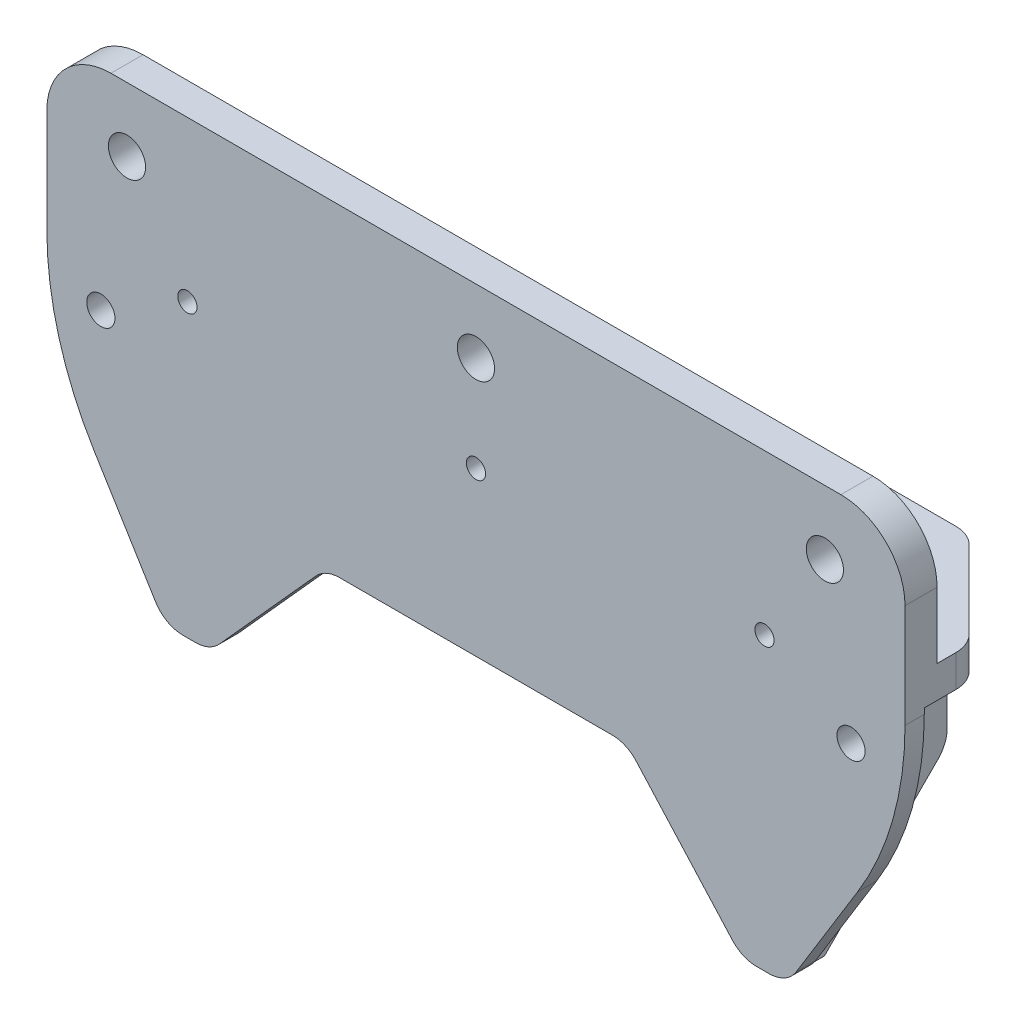
from build123d import *

# Parameters (mm, degrees)
SZKIC1_R                    = 2.9
SZKIC1_W                    = 18.41841252
SZKIC1_H                    = 5
SZKIC1_W_2                  = 7
SZKIC1_H_2                  = 45
SZKIC1_R_2                  = 2.2
SZKIC1_W_3                  = 38
DODANIE_WYCI_GNI_CIE1_DEPTH = 5
SZKIC1_3_W                  = 18.41841252
SZKIC1_3_H                  = 5
SZKIC1_3_W_2                = 7
SZKIC1_3_W_3                = 38
SZKIC1_3_H_2                = 45
DODANIE_WYCI_GNI_CIE2_DEPTH = 20
SFAZOWANIE1_SIZE            = 20
SFAZOWANIE2_SIZE            = 15
WYTNIJ_WYCI_GNI_CIE1_DEPTH  = 82.712994064
SZKIC4_W                    = 7
SZKIC4_H                    = 20
WYTNIJ_WYCI_GNI_CIE2_DEPTH  = 84.078356982
SFAZOWANIE3_SIZE            = 20
ZAOKR_GLENIE1_R             = 5
ZAOKR_GLENIE2_R             = 5
ZAOKR_GLENIE3_R             = 10
SZKIC5_R                    = 1.5
WYTNIJ_WYCI_GNI_CIE3_DEPTH  = 84.078356982
SZKIC6_R                    = 3.5
WYTNIJ_WYCI_GNI_CIE4_DEPTH  = 5
ZAOKR_GLENIE4_R             = 2
ZAOKR_GLENIE5_R             = 5
ZAOKR_GLENIE6_R             = 50
SZKIC7_R                    = 2.8
WYTNIJ_WYCI_GNI_CIE5_DEPTH  = 4.6
SFAZOWANIE4_SIZE            = 2


with BuildPart() as part:
    # Szkic1 → Dodanie-wyciągnięcie1 (new body)
    # profile 1 of 15: a face of its own
    with BuildSketch(Plane.XY):
        Polygon((69.385377552, 17.945036029), (69.385377552, 38.245036029), (-64.451447488, 38.245036029), (-64.451447488, 17.945036029), (-46.033034968, 17.945036029), (-39.033034968, 17.945036029), (-1.033034968, 17.945036029), (5.966965032, 17.945036029), (43.966965032, 17.945036029), (50.966965032, 17.945036029), align=None)
        with Locations((-51.951447488, 28.245036029)):
            Circle(SZKIC1_R, mode=Mode.SUBTRACT)
        with Locations((2.466965032, 28.245036029)):
            Circle(SZKIC1_R, mode=Mode.SUBTRACT)
        with Locations((56.885377552, 28.245036029)):
            Circle(SZKIC1_R, mode=Mode.SUBTRACT)
    # profile 2 of 15: a face of its own
    with BuildSketch(Plane.XY):
        with Locations((60.176171292, 15.445036029)):
            Rectangle(SZKIC1_W, SZKIC1_H)
    # profile 3 of 15: a face of its own
    with BuildSketch(Plane.XY):
        with Locations((47.466965032, 15.445036029)):
            Rectangle(SZKIC1_W_2, SZKIC1_H)
    # profile 4 of 15: a face of its own
    with BuildSketch(Plane.XY):
        with Locations((60.176171292, -9.554963971)):
            Rectangle(SZKIC1_W, SZKIC1_H_2)
        with Locations((60.966965032, 5.445036029)):
            Circle(SZKIC1_R_2, mode=Mode.SUBTRACT)
    # profile 5 of 15: a face of its own
    with BuildSketch(Plane.XY):
        with Locations((-55.242241228, 15.445036029)):
            Rectangle(SZKIC1_W, SZKIC1_H)
    # profile 6 of 15: a face of its own
    with BuildSketch(Plane.XY):
        with Locations((24.966965032, 15.445036029)):
            Rectangle(SZKIC1_W_3, SZKIC1_H)
    # profile 7 of 15: a face of its own
    with BuildSketch(Plane.XY):
        with Locations((47.466965032, -9.554963971)):
            Rectangle(SZKIC1_W_2, SZKIC1_H_2)
    # profile 8 of 15: a face of its own
    with BuildSketch(Plane.XY):
        with Locations((-42.533034968, 15.445036029)):
            Rectangle(SZKIC1_W_2, SZKIC1_H)
    # profile 9 of 15: a face of its own
    with BuildSketch(Plane.XY):
        with Locations((-55.242241228, -9.554963971)):
            Rectangle(SZKIC1_W, SZKIC1_H_2)
        with Locations((-56.033034968, 5.445036029)):
            Circle(SZKIC1_R_2, mode=Mode.SUBTRACT)
    # profile 10 of 15: a face of its own
    with BuildSketch(Plane.XY):
        with Locations((2.466965032, 15.445036029)):
            Rectangle(SZKIC1_W_2, SZKIC1_H)
    # profile 11 of 15: a face of its own
    with BuildSketch(Plane.XY):
        with Locations((24.966965032, -9.554963971)):
            Rectangle(SZKIC1_W_3, SZKIC1_H_2)
    # profile 12 of 15: a face of its own
    with BuildSketch(Plane.XY):
        with Locations((-20.033034968, 15.445036029)):
            Rectangle(SZKIC1_W_3, SZKIC1_H)
    # profile 13 of 15: a face of its own
    with BuildSketch(Plane.XY):
        with Locations((-42.533034968, -9.554963971)):
            Rectangle(SZKIC1_W_2, SZKIC1_H_2)
    # profile 14 of 15: a face of its own
    with BuildSketch(Plane.XY):
        with Locations((2.466965032, -9.554963971)):
            Rectangle(SZKIC1_W_2, SZKIC1_H_2)
    # profile 15 of 15: a face of its own
    with BuildSketch(Plane.XY):
        with Locations((-20.033034968, -9.554963971)):
            Rectangle(SZKIC1_W_3, SZKIC1_H_2)
    extrude(amount=DODANIE_WYCI_GNI_CIE1_DEPTH)

    # Szkic1<3> → Dodanie-wyciągnięcie2 (add)
    with BuildSketch(Plane.XY):
        with Locations((-55.242241228, 15.445036029)):
            Rectangle(SZKIC1_3_W, SZKIC1_3_H)
        with Locations((-42.533034968, 15.445036029)):
            Rectangle(SZKIC1_3_W_2, SZKIC1_3_H)
        with Locations((-20.033034968, 15.445036029)):
            Rectangle(SZKIC1_3_W_3, SZKIC1_3_H)
        with Locations((2.466965032, 15.445036029)):
            Rectangle(SZKIC1_3_W_2, SZKIC1_3_H)
        with Locations((24.966965032, 15.445036029)):
            Rectangle(SZKIC1_3_W_3, SZKIC1_3_H)
        with Locations((47.466965032, 15.445036029)):
            Rectangle(SZKIC1_3_W_2, SZKIC1_3_H)
        with Locations((60.176171292, 15.445036029)):
            Rectangle(SZKIC1_3_W, SZKIC1_3_H)
        with Locations((47.466965032, -9.554963971)):
            Rectangle(SZKIC1_3_W_2, SZKIC1_3_H_2)
        with Locations((2.466965032, -9.554963971)):
            Rectangle(SZKIC1_3_W_2, SZKIC1_3_H_2)
        with Locations((-42.533034968, -9.554963971)):
            Rectangle(SZKIC1_3_W_2, SZKIC1_3_H_2)
    extrude(amount=-DODANIE_WYCI_GNI_CIE2_DEPTH)

    # Sfazowanie1
    sfazowanie1_edges = [part.edges().sort_by_distance(p)[0] for p in [
        (47.466965032, -32.054963971, -20),
        (2.466965032, -32.054963971, -20),
        (-42.533034968, -32.054963971, -20),
    ]]
    chamfer(sfazowanie1_edges, length=SFAZOWANIE1_SIZE)

    # Sfazowanie2
    sfazowanie2_edges = [part.edges().sort_by_distance(p)[0] for p in [
        (-64.451447488, 15.445036029, -20),
        (69.385377552, 15.445036029, -20),
    ]]
    chamfer(sfazowanie2_edges, length=SFAZOWANIE2_SIZE)

    # Szkic3 → Wytnij-wyciągnięcie1 (cut, through all)
    with BuildSketch(Plane(origin=(0, 0, 0), x_dir=(-1, 0, 0), z_dir=(0, 0, -1))):
        Polygon((-69.385377552, -2.054963971), (-50.966965032, -32.054963971), (-69.385377552, -32.054963971), align=None)
        Polygon((64.451447488, -32.054963971), (64.451447488, -2.054963971), (46.033034968, -32.054963971), align=None)
    extrude(amount=-WYTNIJ_WYCI_GNI_CIE1_DEPTH, mode=Mode.SUBTRACT)

    # Szkic4 → Wytnij-wyciągnięcie2 (cut, through all)
    with BuildSketch(Plane(origin=(0, 0, -20), x_dir=(-1, 0, 0), z_dir=(0, 0, -1))):
        Polygon((21.033034968, -12.054963971), (-25.966965032, -12.054963971), (-43.966965032, -32.054963971), (39.033034968, -32.054963971), align=None)
        with Locations((-2.466965032, -22.054963971)):
            Rectangle(SZKIC4_W, SZKIC4_H)
    extrude(amount=-WYTNIJ_WYCI_GNI_CIE2_DEPTH, mode=Mode.SUBTRACT)

    # Sfazowanie3
    sfazowanie3_edges = [part.edges().sort_by_distance(p)[0] for p in [
        (2.466965032, -12.054963971, -20),
    ]]
    chamfer(sfazowanie3_edges, length=SFAZOWANIE3_SIZE)

    # Zaokrąglenie1
    zaokr_glenie1_edges = [part.edges().sort_by_distance(p)[0] for p in [
        (-46.033034968, 12.945036029, -10),
        (-39.033034968, 12.945036029, -10),
        (-1.033034968, 12.945036029, -10),
        (5.966965032, 12.945036029, -10),
        (43.966965032, 12.945036029, -10),
        (50.966965032, 12.945036029, -10),
    ]]
    fillet(zaokr_glenie1_edges, radius=ZAOKR_GLENIE1_R)

    # Zaokrąglenie2
    zaokr_glenie2_edges = [part.edges().sort_by_distance(p)[0] for p in [
        (-64.451447488, 15.445036029, -5),
        (54.385377552, 15.316669487, -20),
        (-49.451447488, 15.316669487, -20),
        (69.385377552, 15.445036029, -5),
        (50.966965032, -32.054963971, 2.5),
        (-46.033034968, -32.054963971, 2.5),
        (43.966965032, -32.054963971, 2.5),
        (-39.033034968, -32.054963971, 2.5),
        (-42.533034968, -12.054963971, -20),
        (47.466965032, -12.054963971, -20),
    ]]
    fillet(zaokr_glenie2_edges, radius=ZAOKR_GLENIE2_R)

    # Zaokrąglenie3
    zaokr_glenie3_edges = [part.edges().sort_by_distance(p)[0] for p in [
        (-64.451447488, 38.245036029, 2.5),
        (69.385377552, 38.245036029, 2.5),
    ]]
    fillet(zaokr_glenie3_edges, radius=ZAOKR_GLENIE3_R)

    # Szkic5 → Wytnij-wyciągnięcie3 (cut, through all)
    with BuildSketch(Plane(origin=(0, 0, -20), x_dir=(-1, 0, 0), z_dir=(0, 0, -1))):
        with Locations((-2.466965032, 13.335528763)):
            Circle(SZKIC5_R)
        with Locations((-47.466965032, 13.335528763)):
            Circle(SZKIC5_R)
        with Locations(Location((42.533034968, 13.335528763, 0), (0, 0, 180))):
            Circle(SZKIC5_R)
    extrude(amount=-WYTNIJ_WYCI_GNI_CIE3_DEPTH, mode=Mode.SUBTRACT)

    # Szkic6 → Wytnij-wyciągnięcie4 (cut)
    with BuildSketch(Plane(origin=(0, 0, -20), x_dir=(-1, 0, 0), z_dir=(0, 0, -1))):
        with Locations((-47.466965032, 13.335528763)):
            Circle(SZKIC6_R)
        with Locations((-2.466965032, 13.335528763)):
            Circle(SZKIC6_R)
        with Locations((42.533034968, 13.335528763)):
            Circle(SZKIC6_R)
    extrude(amount=-WYTNIJ_WYCI_GNI_CIE4_DEPTH, mode=Mode.SUBTRACT)

    # Zaokrąglenie4
    zaokr_glenie4_edges = [part.edges().sort_by_distance(p)[0] for p in [
        (2.466965032, 7.945036029, -20),
    ]]
    fillet(zaokr_glenie4_edges, radius=ZAOKR_GLENIE4_R)

    # Zaokrąglenie5
    zaokr_glenie5_edges = [part.edges().sort_by_distance(p)[0] for p in [
        (-21.033034968, -12.054963971, 2.5),
        (25.966965032, -12.054963971, 2.5),
    ]]
    fillet(zaokr_glenie5_edges, radius=ZAOKR_GLENIE5_R)

    # Zaokrąglenie6
    zaokr_glenie6_edges = [part.edges().sort_by_distance(p)[0] for p in [
        (69.385377552, -2.054963971, 2.5),
        (-64.451447488, -2.054963971, 2.5),
    ]]
    fillet(zaokr_glenie6_edges, radius=ZAOKR_GLENIE6_R)

    # Szkic7 → Wytnij-wyciągnięcie5 (cut)
    with BuildSketch(Plane.XZ.offset(-12.945036029)):
        with Locations(Location((24.966965032, -10.3, 0), (0, 0, 270))):
            Circle(SZKIC7_R)
        with Locations(Location((-20.033034968, -10.3, 0), (0, 0, 270))):
            Circle(SZKIC7_R)
    extrude(amount=-WYTNIJ_WYCI_GNI_CIE5_DEPTH, mode=Mode.SUBTRACT)

    # Sfazowanie4
    # the kernel refuses this chamfer: 2 mm, written as the material it takes off along each edge
    with BuildSketch(Plane(origin=(-1.033034968, -12.054963971, 0), x_dir=(0, -0.027495876610586494, 0.9996219169112968), z_dir=(-1, 0, 0)), Plane(origin=(23.740153008, -12.054963971, 0), x_dir=(0, -0.027495876610586487, 0.9996219169112968), z_dir=(-1, 0, 0))) as sfazowanie4_piece_1:
        Polygon((SFAZOWANIE4_SIZE * 0.999621916911, SFAZOWANIE4_SIZE * 0.0274958766106), (-SFAZOWANIE4_SIZE * 0.0274958766106, SFAZOWANIE4_SIZE * 0.999621916911), (0, 0), align=None)
    extrude(amount=17.773187976, mode=Mode.SUBTRACT)
    with BuildSketch(Plane(origin=(-43.23563518, -27.054963971, 0), x_dir=(0.42136088994034965, -0.906893047954761, 0), z_dir=(0.906893047954761, 0.42136088994034965, 0))) as sfazowanie4_piece_2_section:
        Polygon((5, -SFAZOWANIE4_SIZE), (5 - SFAZOWANIE4_SIZE, 0), (5, 0), align=None)
    sfazowanie4_piece_2 = revolve(axis=Axis((-43.23563518, -27.054963971, 0), (0, 0, -1)), revolution_arc=83.372812861, mode=Mode.PRIVATE)
    sfazowanie4_piece_2 = split(sfazowanie4_piece_2, bisect_by=Plane(origin=(-46.033034968, -30.045933354, 0.764134298), z_dir=(-1, 0, 0)), keep=Keep.TOP, mode=Mode.PRIVATE)
    add(sfazowanie4_piece_2, mode=Mode.SUBTRACT)
    with BuildSketch(Plane(origin=(-22.522693676, -13.710140313, 0), x_dir=(0.02043752413058321, -0.01839377171752488, 0.9996219169112968), z_dir=(-0.6689647316224495, -0.7432941462471666, 0)), Plane(origin=(42.477306324, -30.399787629, 0), x_dir=(-0.02043752413058301, -0.018393771717524706, 0.9996219169112968), z_dir=(-0.6689647316224496, 0.7432941462471665, 0))) as sfazowanie4_piece_3:
        Polygon((SFAZOWANIE4_SIZE * 0.999621916911, SFAZOWANIE4_SIZE * 0.0274958766106), (-SFAZOWANIE4_SIZE * 0.0274958766106, SFAZOWANIE4_SIZE * 0.999621916911), (0, 0), align=None)
    extrude(amount=22.453624047, mode=Mode.SUBTRACT)
    with BuildSketch(Plane(origin=(-41.259846992, -27.054963971, 0), x_dir=(-0.5372033961854771, -0.8434527320050539, 0), z_dir=(-0.8434527320050539, 0.5372033961854771, 0))) as sfazowanie4_piece_4_section:
        Polygon((5, SFAZOWANIE4_SIZE), (5 - SFAZOWANIE4_SIZE, 0), (5, 0), align=None)
    sfazowanie4_piece_4 = revolve(axis=Axis((-41.259846992, -27.054963971, 0), (0, 0, 1)), revolution_arc=80.506251571, mode=Mode.PRIVATE)
    sfazowanie4_piece_4 = split(sfazowanie4_piece_4, bisect_by=Plane(origin=(-39.033034968, -30.533722869, 0.745420037), z_dir=(1, 0, 0)), keep=Keep.TOP, mode=Mode.PRIVATE)
    add(sfazowanie4_piece_4, mode=Mode.SUBTRACT)
    with BuildSketch(Plane(origin=(46.193777055, -27.054963971, 0), x_dir=(0.5372033961854854, -0.8434527320050487, 0), z_dir=(0.8434527320050487, 0.5372033961854854, 0))) as sfazowanie4_piece_5_section:
        Polygon((5, -SFAZOWANIE4_SIZE), (5 - SFAZOWANIE4_SIZE, 0), (5, 0), align=None)
    sfazowanie4_piece_5 = revolve(axis=Axis((46.193777055, -27.054963971, 0), (0, 0, -1)), revolution_arc=80.506251571, mode=Mode.PRIVATE)
    sfazowanie4_piece_5 = split(sfazowanie4_piece_5, bisect_by=Plane(origin=(43.966965032, -30.533722869, 0.745420037), z_dir=(-1, 0, 0)), keep=Keep.TOP, mode=Mode.PRIVATE)
    add(sfazowanie4_piece_5, mode=Mode.SUBTRACT)
    with BuildSketch(Plane(origin=(61.995610849, -14.09145196, 0), x_dir=(0.02343211434184364, -0.014386078272250682, 0.9996219169112968), z_dir=(-0.5232085696337507, -0.8522046659469805, 0))) as sfazowanie4_piece_6_section:
        Polygon((SFAZOWANIE4_SIZE * 0.999621916911, SFAZOWANIE4_SIZE * 0.0274958766106), (-SFAZOWANIE4_SIZE * 0.0274958766106, SFAZOWANIE4_SIZE * 0.999621916911), (0, 0), align=None)
    sfazowanie4_piece_6 = extrude(amount=18.281470968, mode=Mode.PRIVATE)
    sfazowanie4_piece_6 = split(sfazowanie4_piece_6, bisect_by=Plane(origin=(50.966965032, -23.432298347, 0.774377274), z_dir=(1, 0, 0)), keep=Keep.TOP, mode=Mode.PRIVATE)
    add(sfazowanie4_piece_6, mode=Mode.SUBTRACT)
    with BuildSketch(Plane(origin=(48.169565244, -27.054963971, 0), x_dir=(-0.4213608899403493, -0.9068930479547611, 0), z_dir=(-0.9068930479547611, 0.4213608899403493, 0))) as sfazowanie4_piece_7_section:
        Polygon((5, SFAZOWANIE4_SIZE), (5 - SFAZOWANIE4_SIZE, 0), (5, 0), align=None)
    sfazowanie4_piece_7 = revolve(axis=Axis((48.169565244, -27.054963971, 0), (0, 0, 1)), revolution_arc=83.372812861, mode=Mode.PRIVATE)
    sfazowanie4_piece_7 = split(sfazowanie4_piece_7, bisect_by=Plane(origin=(50.966965032, -30.045933354, 0.764134298), z_dir=(1, 0, 0)), keep=Keep.TOP, mode=Mode.PRIVATE)
    add(sfazowanie4_piece_7, mode=Mode.SUBTRACT)
    with BuildSketch(Plane(origin=(-64.451447488, 12.068976521, 0), x_dir=(-0.02749587661058217, 0, 0.9996219169112968), z_dir=(0, 1, 0))) as sfazowanie4_piece_8:
        Polygon((SFAZOWANIE4_SIZE * 0.999621916911, SFAZOWANIE4_SIZE * 0.0274958766106), (-SFAZOWANIE4_SIZE * 0.0274958766106, SFAZOWANIE4_SIZE * 0.999621916911), (0, 0), align=None)
    extrude(amount=0.876059508, mode=Mode.SUBTRACT)
    with BuildSketch(Plane(origin=(69.385377552, 12.068976521, 0), x_dir=(0.02749587661058908, 0, 0.9996219169112968), z_dir=(0, 1, 0))) as sfazowanie4_piece_9:
        Polygon((SFAZOWANIE4_SIZE * 0.999621916911, -SFAZOWANIE4_SIZE * 0.0274958766106), (-SFAZOWANIE4_SIZE * 0.0274958766106, -SFAZOWANIE4_SIZE * 0.999621916911), (0, 0), align=None)
    extrude(amount=0.876059508, mode=Mode.SUBTRACT)
    with BuildSketch(Plane(origin=(-18.806222945, -17.054963971, 0), x_dir=(-0.7432941462471667, 0.6689647316224491, 0), z_dir=(-0.6689647316224491, -0.7432941462471667, 0))) as sfazowanie4_piece_10:
        Polygon((5, -SFAZOWANIE4_SIZE), (5 + SFAZOWANIE4_SIZE, 0), (5, 0), align=None)
    revolve(axis=Axis((-18.806222945, -17.054963971, 0), (0, 0, -1)), revolution_arc=48.012787504, mode=Mode.SUBTRACT)
    with BuildSketch(Plane(origin=(23.740153008, -17.054963971, 0), x_dir=(0, 1, 0), z_dir=(-1, 0, 0))) as sfazowanie4_piece_11:
        Polygon((5, -SFAZOWANIE4_SIZE), (5 + SFAZOWANIE4_SIZE, 0), (5, 0), align=None)
    revolve(axis=Axis((23.740153008, -17.054963971, 0), (0, 0, -1)), revolution_arc=48.012787504, mode=Mode.SUBTRACT)
    with BuildSketch(Plane(origin=(19.385377552, 12.068976521, 0), x_dir=(0.8522046659469805, -0.5232085696337508, 0), z_dir=(-0.5232085696337508, -0.8522046659469805, 0))) as sfazowanie4_piece_12:
        Polygon((50, SFAZOWANIE4_SIZE), (50 - SFAZOWANIE4_SIZE, 0), (50, 0), align=None)
    revolve(axis=Axis((19.385377552, 12.068976521, 0), (0, 0, 1)), revolution_arc=31.54772315, mode=Mode.SUBTRACT)
    with BuildSketch(Plane(origin=(-57.061680786, -14.09145196, 0), x_dir=(-0.023432114341843627, -0.014386078272250705, 0.9996219169112968), z_dir=(0.5232085696337515, -0.8522046659469801, 0))) as sfazowanie4_piece_13_section:
        Polygon((SFAZOWANIE4_SIZE * 0.999621916911, -SFAZOWANIE4_SIZE * 0.0274958766106), (-SFAZOWANIE4_SIZE * 0.0274958766106, -SFAZOWANIE4_SIZE * 0.999621916911), (0, 0), align=None)
    sfazowanie4_piece_13 = extrude(amount=18.281470968, mode=Mode.PRIVATE)
    sfazowanie4_piece_13 = split(sfazowanie4_piece_13, bisect_by=Plane(origin=(-46.033034968, -23.432298347, 0.774377274), z_dir=(-1, 0, 0)), keep=Keep.TOP, mode=Mode.PRIVATE)
    add(sfazowanie4_piece_13, mode=Mode.SUBTRACT)
    with BuildSketch(Plane(origin=(-14.451447488, 12.068976521, 0), x_dir=(-0.8522046659469801, -0.5232085696337514, 0), z_dir=(0.5232085696337514, -0.8522046659469801, 0))) as sfazowanie4_piece_14:
        Polygon((50, -SFAZOWANIE4_SIZE), (50 - SFAZOWANIE4_SIZE, 0), (50, 0), align=None)
    revolve(axis=Axis((-14.451447488, 12.068976521, 0), (0, 0, -1)), revolution_arc=31.54772315, mode=Mode.SUBTRACT)


solid = part.part
